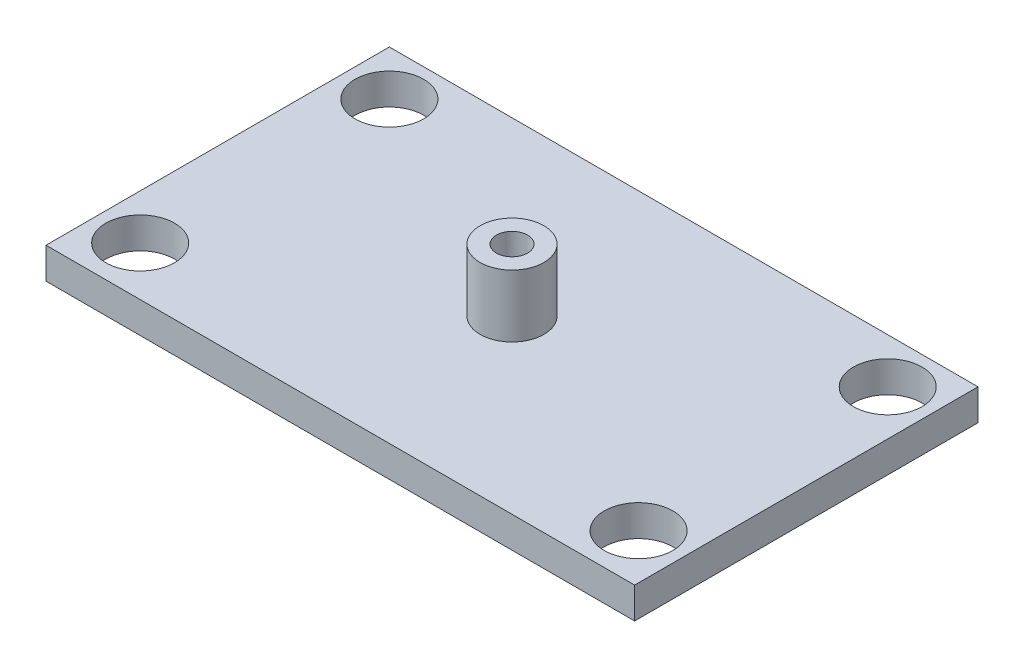
from build123d import *

# Parameters (mm, degrees)
SKETCH1_W           = 60
SKETCH1_H           = 35
SKETCH1_R           = 3.5
SKETCH1_R_2         = 1.25
BOSS_EXTRUDE1_DEPTH = 9.525
SKETCH2_W           = 60
SKETCH2_H           = 35
SKETCH2_R           = 3.25
CUT_EXTRUDE1_DEPTH  = 6.35
SKETCH4_R           = 1.59
CUT_EXTRUDE2_DEPTH  = 6.35


with BuildPart() as part:
    # Sketch1 → Boss-Extrude1 (new body)
    with BuildSketch(Plane(origin=(0, 0, 0), x_dir=(1, 0, 0), z_dir=(0, 1, 0))):
        with Locations((30, 17.5)):
            Rectangle(SKETCH1_W, SKETCH1_H)
        with Locations((4.6, 30.4)):
            Circle(SKETCH1_R, mode=Mode.SUBTRACT)
        with Locations((55.4, 30.4)):
            Circle(SKETCH1_R, mode=Mode.SUBTRACT)
        with Locations((4.6, 5)):
            Circle(SKETCH1_R, mode=Mode.SUBTRACT)
        with Locations((55.4, 5)):
            Circle(SKETCH1_R, mode=Mode.SUBTRACT)
        with Locations((30, 17.5)):
            Circle(SKETCH1_R_2, mode=Mode.SUBTRACT)
    extrude(amount=BOSS_EXTRUDE1_DEPTH)

    # Sketch2 → Cut-Extrude1 (cut)
    with BuildSketch(Plane(origin=(0, 9.525, 0), x_dir=(1, 0, 0), z_dir=(0, 1, 0))):
        with Locations((30, 17.5)):
            Rectangle(SKETCH2_W, SKETCH2_H)
        with Locations((30, 17.5)):
            Circle(SKETCH2_R, mode=Mode.SUBTRACT)
    extrude(amount=-CUT_EXTRUDE1_DEPTH, mode=Mode.SUBTRACT)

    # Sketch4 → Cut-Extrude2 (cut)
    with BuildSketch(Plane(origin=(0, 9.525, 0), x_dir=(1, 0, 0), z_dir=(0, 1, 0))):
        with Locations((30, 17.5)):
            Circle(SKETCH4_R)
    extrude(amount=-CUT_EXTRUDE2_DEPTH, mode=Mode.SUBTRACT)


solid = part.part
